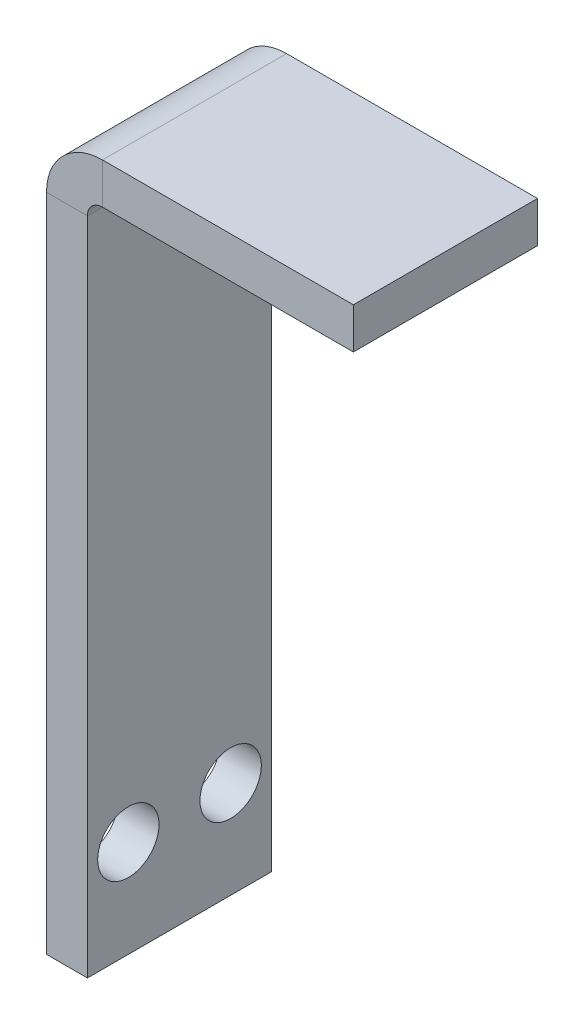
from build123d import *

# Parameters (mm, degrees)
SM_BASE_FLANGE_1_DEPTH = 4.5
SKETCH_6_R             = 1.5
CUT_EXTRUDE_1_DEPTH    = 10


# Sheet-metal steps are written as plain solids
with BuildPart() as part:
    # Sketch 1 → 基体-法兰1 (new, symmetric)
    with BuildSketch(Plane.XY):
        with BuildLine():
            Line((0, 0), (0, 32.2634))
            ThreePointArc((0, 32.2634), (0.801531583, 34.198468417), (2.7366, 35))
            Line((2.7366, 35), (15, 35))
            Line((15, 35), (15, 33))
            Line((15, 33), (2.7366, 33))
            ThreePointArc((2.7366, 33), (2.215745145, 32.784254855), (2, 32.2634))
            Line((2, 32.2634), (2, 0))
            Line((2, 0), (0, 0))
        make_face()
    extrude(amount=SM_BASE_FLANGE_1_DEPTH, both=True)

    # 草图6 → 切除-拉伸1 (cut)
    with BuildSketch(Plane.ZY):
        with Locations((2.5, 4.75181822)):
            Circle(SKETCH_6_R)
        with Locations((-2.5, 4.75181822)):
            Circle(SKETCH_6_R)
    extrude(amount=-CUT_EXTRUDE_1_DEPTH, mode=Mode.SUBTRACT)


solid = part.part
